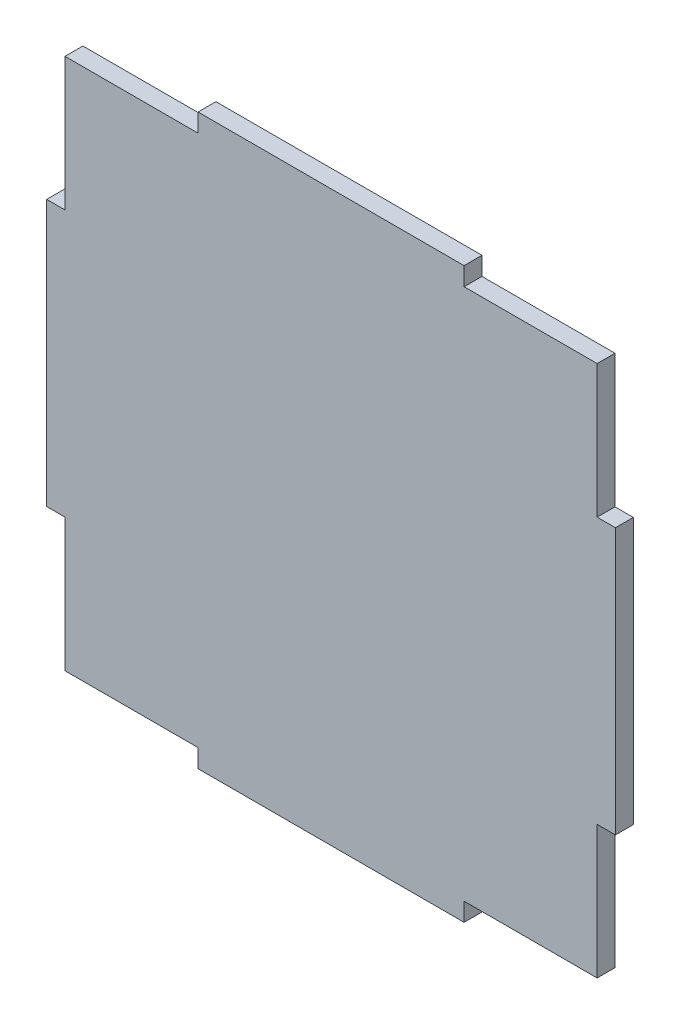
from build123d import *

# Parameters (mm, degrees)
SKETCH1_W           = 100
SKETCH1_H           = 100
BOSS_EXTRUDE1_DEPTH = 3.36
SKETCH8_W           = 50
SKETCH8_H           = 3.44
BOSS_EXTRUDE4_DEPTH = 3.36
SKETCH9_W           = 3.44
SKETCH9_H           = 50
BOSS_EXTRUDE5_DEPTH = 3.36


with BuildPart() as part:
    # Sketch1 → Boss-Extrude1 (new body)
    with BuildSketch(Plane.XY):
        Rectangle(SKETCH1_W, SKETCH1_H)
    extrude(amount=BOSS_EXTRUDE1_DEPTH)

    # Sketch8 → Boss-Extrude4 (add)
    with BuildSketch(Plane(origin=(0, 0, 0), x_dir=(-1, 0, 0), z_dir=(0, 0, -1))):
        with Locations((0, 51.72)):
            Rectangle(SKETCH8_W, SKETCH8_H)
    boss_extrude4 = extrude(amount=-BOSS_EXTRUDE4_DEPTH)

    # Mirror4: Boss-Extrude4 across plane
    add(boss_extrude4.mirror(Plane.ZX))

    # Sketch9 → Boss-Extrude5 (add)
    with BuildSketch(Plane(origin=(0, 0, 0), x_dir=(-1, 0, 0), z_dir=(0, 0, -1))):
        with Locations((51.72, 0)):
            Rectangle(SKETCH9_W, SKETCH9_H)
    boss_extrude5 = extrude(amount=-BOSS_EXTRUDE5_DEPTH)

    # Mirror5: Boss-Extrude5 across plane
    add(boss_extrude5.mirror(Plane(origin=(0, 0, 0), x_dir=(0, 0, 1), z_dir=(1, 0, 0))))


solid = part.part
